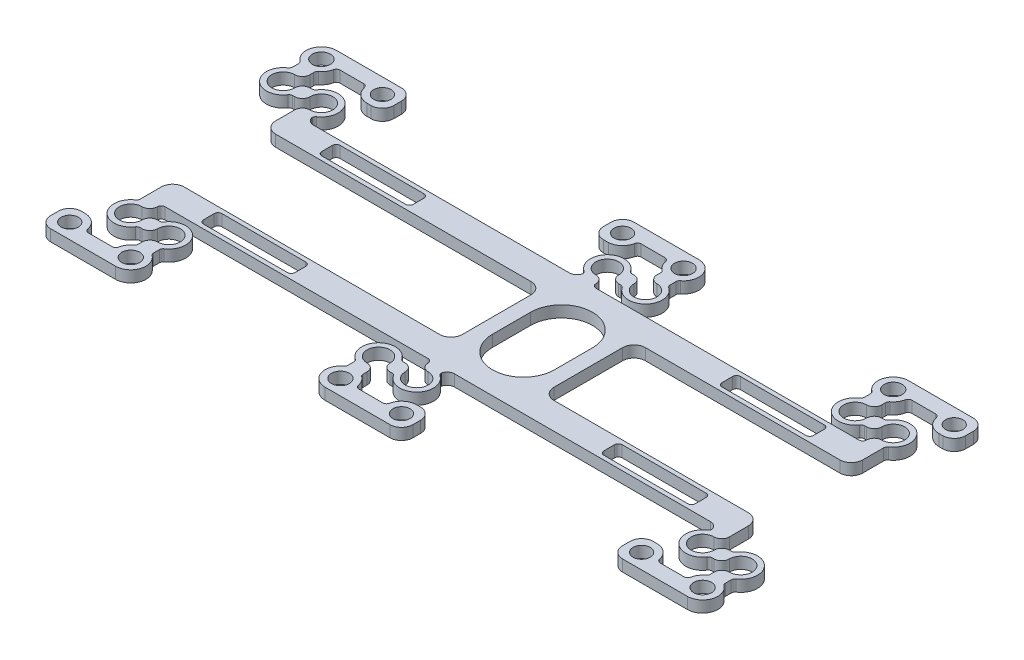
from build123d import *

# Parameters (mm, degrees)
SKETCH1_R           = 2.2500000000000027
SKETCH1_R_2         = 2.3499999999999437
SKETCH1_W           = 24.000000000000004
SKETCH1_H           = 4.799999999999997
SKETCH1_R_3         = 2.2499999999999964
SKETCH1_R_4         = 2.350000007263345
SKETCH1_W_2         = 23.999999999999986
SKETCH1_H_2         = 4.799999999999969
SKETCH1_R_5         = 2.349999999999996
SKETCH1_R_6         = 2.2499999999999987
SKETCH1_R_7         = 2.350000000000016
SKETCH1_R_8         = 2.3500000000368715
BOSS_EXTRUDE1_DEPTH = 3
FILLET1_R           = 3
FILLET2_R           = 2
FILLET3_R           = 1
FILLET4_R           = 3
FILLET5_R           = 1
FILLET6_R           = 2


# Some blends are built 0.0001 mm under size
with BuildPart() as part:
    # Sketch1 → Boss-Extrude1 (new body)
    with BuildSketch(Plane(origin=(0, 33.94852974075286, 0), x_dir=(1, 0, 0), z_dir=(0, 1, 0))):
        with BuildLine():
            Line((-33.51582642738949, -17.917871814791713), (-53.515826427389484, -17.917871814791713))
            ThreePointArc((-53.515826427389484, -17.91787181479171), (-57.379529732545755, -20.882595634381627), (-55.51582642738949, -25.381973429929463))
            Line((-55.51582642738949, -25.381973429929467), (-55.515826427389484, -27.998688226338622))
            ThreePointArc((-55.515826427389484, -27.998688226338622), (-56.627096264610294, -35.02914165201251), (-49.596642838936404, -33.91787181479171))
            Line((-49.596642838936404, -33.91787181479171), (-45.75189440488929, -33.91787181479171))
            ThreePointArc((-45.75189440488929, -33.91787181479171), (-41.39450608382999, -29.796551471231936), (-45.51582642738949, -34.1539397922915))
            Line((-45.51582642738949, -34.1539397922915), (-45.51582642738949, -44.9178718147917))
            Line((-45.51582642738949, -44.9178718147917), (27.484173572610494, -44.9178718147917))
            Line((27.484173572610498, -44.9178718147917), (27.4841735726105, -68.91787181479168))
            Line((27.48417357261051, -68.91787181479168), (-45.51582642738949, -68.9178718147917))
            Line((-45.51582642738949, -68.9178718147917), (-45.515826427389484, -77.99868822633861))
            ThreePointArc((-45.515826427389484, -77.99868822633861), (-46.6270950590721, -85.02914285755026), (-39.59664128903926, -83.91786877762306))
            Line((-39.59664128903926, -83.91786877762306), (-35.75189712141177, -83.91786877762308))
            ThreePointArc((-35.751897121411766, -83.91786877762308), (-31.394504643175516, -79.79655291188737), (-35.51582642738955, -84.15393979229145))
            Line((-35.51582642738955, -84.15393979229145), (-35.51582642738955, -88.4687935184171))
            ThreePointArc((-35.51582642738955, -88.4687935184171), (-36.97054306521985, -89.9276270944568), (-37.502822927829754, -91.91787181479171))
            Line((-37.502822927829754, -91.91787181479171), (-45.51229915471252, -91.91787181479172))
            ThreePointArc((-45.512299154712515, -91.91787181479172), (-46.684580482487576, -89.08727523058104), (-49.51490809269906, -87.91434464743907))
            Line((-49.51490809269906, -87.91434464743907), (-53.51575887941135, -87.91346264172846))
            Line((-53.51575887941135, -87.91346264172846), (-53.51589382775335, -95.91346264059027))
            Line((-53.51589382775335, -95.91346264059027), (-33.516708278678145, -95.91787171758399))
            ThreePointArc((-33.516708278678145, -95.91787171758399), (-29.652237265662105, -92.95357389038188), (-31.51582642738954, -88.45377019965397))
            Line((-31.515826427389545, -88.45377019965397), (-31.515826427389545, -85.83705546221402))
            ThreePointArc((-31.515826427389534, -85.83705546221404), (-30.404557759626346, -78.80660077097274), (-37.43501159522431, -79.91787485196033))
            Line((-37.43501159522432, -79.91787485196033), (-41.27975573336721, -79.91787485196035))
            ThreePointArc((-41.27975573336721, -79.91787485196035), (-45.63714821160335, -84.03919071769616), (-41.5158264273895, -79.68180383729192))
            Line((-41.5158264273895, -79.68180383729192), (-41.515826427389506, -75.91787181479172))
            Line((-41.515826427389506, -75.91787181479172), (29.484173572610523, -75.91787181479172))
            Line((29.484173572610516, -75.91787181479172), (29.48417357261051, -79.6818038372919))
            ThreePointArc((29.484173572610505, -79.6818038372919), (33.60549535682436, -84.03919071769613), (29.248102878588217, -79.91787485196032))
            Line((29.24810287858822, -79.91787485196032), (25.40335874044533, -79.91787485196033))
            ThreePointArc((25.40335874044533, -79.91787485196033), (18.37290490484736, -78.80660077097271), (19.484173572610562, -85.83705546221401))
            Line((19.48417357261056, -85.83705546221402), (19.48417357261056, -88.45377019965395))
            ThreePointArc((19.48417357261056, -88.45377019965395), (17.620584410883133, -92.95357389038183), (21.485055423899155, -95.91787171758394))
            Line((21.485055423899155, -95.91787171758394), (41.48424097297437, -95.91346264059021))
            Line((41.48424097297437, -95.91346264059021), (41.48410602463237, -87.91346264172846))
            Line((41.48410602463237, -87.91346264172846), (37.48325523792007, -87.91434464743907))
            ThreePointArc((37.48325523792007, -87.91434464743907), (34.65292762770859, -89.08727523058104), (33.48064629993353, -91.91787181479172))
            Line((33.48064629993353, -91.91787181479172), (25.471170073050768, -91.91787181479168))
            ThreePointArc((25.471170073050768, -91.91787181479168), (24.93889021044086, -89.92762709445677), (23.484173572610562, -88.46879351841707))
            Line((23.484173572610562, -88.46879351841707), (23.484173572610562, -84.15393979229142))
            ThreePointArc((23.48417357261056, -84.15393979229142), (19.362851788396537, -79.79655291188733), (23.720244266632783, -83.91786877762306))
            Line((23.720244266632786, -83.91786877762306), (27.564988434260272, -83.91786877762306))
            ThreePointArc((27.564988434260275, -83.91786877762306), (34.595442204293086, -85.02914285755023), (33.4841735726105, -77.99868822633861))
            Line((33.4841735726105, -77.99868822633861), (33.48417357261051, -75.91787181479171))
            Line((33.48417357261051, -75.91787181479171), (104.48411814011325, -75.91787181479174))
            Line((104.48411814011327, -75.91787181479174), (104.48473276035557, -77.99998738923574))
            ThreePointArc((104.48473276035557, -77.99998738923573), (103.37353901468369, -85.03097705004149), (110.40425647478723, -83.9180623421807))
            Line((110.40425647478725, -83.91806234218072), (114.24820906374711, -83.91806979449323))
            ThreePointArc((114.24820906374711, -83.91806979449323), (118.60545235287597, -79.79649525390121), (114.4841735662863, -84.15401828166834))
            Line((114.4841735662863, -84.15401828166834), (114.4841735662863, -88.45377029145757))
            ThreePointArc((114.4841735662863, -88.45377029145757), (113.02007180993759, -89.91787192195076), (112.48417336776805, -91.91787202120989))
            Line((112.48417336776805, -91.91787202120989), (104.48417336776805, -91.91787202120987))
            ThreePointArc((104.48417336776805, -91.91787202120987), (103.31260049251424, -89.08944489646369), (100.48417336776805, -87.91787202120989))
            Line((100.48417336776805, -87.91787202120989), (96.48417336776805, -87.91787202120987))
            Line((96.48417336776805, -87.91787202120987), (96.48417336776805, -95.9178720212099))
            Line((96.48417336776805, -95.9178720212099), (116.48417336776805, -95.91787202120992))
            ThreePointArc((116.48417336776805, -95.91787202120992), (120.34787664330945, -92.95314831214436), (118.48417356595493, -88.4537705204954))
            Line((118.48417356595493, -88.4537705204954), (118.48417356595493, -85.83709832436479))
            ThreePointArc((118.48417356595493, -85.83709832436479), (119.59539119652722, -78.80658254766834), (112.5649175150346, -79.91806647589769))
            Line((112.5649175150346, -79.91806647589769), (108.71936209293261, -79.9180594027779))
            ThreePointArc((108.71936209293261, -79.9180594027779), (104.36385600436591, -84.04139483513454), (108.48411814011325, -79.68298132698779))
            Line((108.48411814011325, -79.68298132698779), (108.48411814011325, -77.99868822633863))
            Line((108.48411814011325, -77.99868822633863), (108.48411814011324, -75.89591879788168))
            Line((108.48411814011324, -75.89591879788168), (108.48411814011324, -68.9178718147917))
            Line((108.48411814011324, -68.9178718147917), (51.484173572610494, -68.91787181479168))
            Line((51.484173572610494, -68.91787181479168), (51.484173572610494, -44.9178718147917))
            Line((51.484173572610494, -44.9178718147917), (101.01451384384951, -44.9178718147917))
            Line((101.01451384384951, -44.9178718147917), (108.48411814011324, -44.9178718147917))
            Line((108.48411814011324, -44.9178718147917), (108.48411814011328, -37.939824831701735))
            Line((108.48411814011328, -37.939824831701735), (108.48411814011325, -35.83705540324479))
            ThreePointArc((108.48411814011325, -35.8370554032448), (109.59538797733406, -28.806601977570892), (102.56493455166016, -29.91787181479172))
            Line((102.56493455166016, -29.91787181479172), (98.72018611761308, -29.91787181479172))
            ThreePointArc((98.72018611761308, -29.917871814791724), (94.3627977965534, -34.03919215835108), (98.4841181401133, -29.681803837291916))
            Line((98.4841181401133, -29.68180383729192), (98.48411814011328, -25.381973429929626))
            ThreePointArc((98.48411814011328, -25.38197342992963), (99.94821999991288, -23.917871391025184), (100.4841181401133, -21.91787083614463))
            Line((100.4841181401133, -21.91787083614463), (108.48411814011328, -21.91787148857602))
            ThreePointArc((108.48411814011328, -21.91787148857602), (109.65569090003244, -24.746298824203237), (112.4841181401133, -25.917871814791713))
            Line((112.4841181401133, -25.917871814791713), (116.48411814011328, -25.917871814791713))
            Line((116.48411814011328, -25.917871814791713), (116.48411814011328, -17.917871814791713))
            Line((116.48411814011328, -17.917871814791713), (96.48411814011328, -17.917871814791713))
            ThreePointArc((96.48411814011328, -17.91787181479171), (92.620414834957, -20.882595634381627), (94.48411814011328, -25.381973429929467))
            Line((94.48411814011328, -25.381973429929467), (94.48411814011328, -27.998688226338622))
            ThreePointArc((94.48411814011328, -27.99868822633862), (93.37284830289248, -35.02914165201251), (100.40330172856638, -33.917871814791724))
            Line((100.40330172856638, -33.917871814791724), (104.24805016261348, -33.917871814791724))
            ThreePointArc((104.24805016261348, -33.917871814791724), (108.6054384836728, -29.796551471231954), (104.48411814011327, -34.153939792291496))
            Line((104.48411814011327, -34.1539397922915), (104.48411814011327, -37.91787181479169))
            Line((104.48411814011325, -37.91787181479169), (33.48417357261051, -37.9178718147917))
            Line((33.48417357261051, -37.9178718147917), (33.48417357261051, -34.1539397922915))
            ThreePointArc((33.48417357261051, -34.1539397922915), (29.362853229050856, -29.796551471232064), (33.7202415501103, -33.91787181479171))
            Line((33.7202415501103, -33.91787181479171), (37.564989984157414, -33.91787181479171))
            ThreePointArc((37.564989984157414, -33.91787181479171), (44.59544340983131, -35.02914165201252), (43.484173572610494, -27.99868822633862))
            Line((43.484173572610494, -27.998688226338622), (43.4841735726105, -25.381973429929467))
            ThreePointArc((43.4841735726105, -25.381973429929467), (45.34787687776677, -20.88259563438163), (41.4841735726105, -17.91787181479171))
            Line((41.4841735726105, -17.917871814791713), (21.4841735726105, -17.917871814791713))
            Line((21.4841735726105, -17.917871814791713), (21.4841735726105, -25.917871814791713))
            Line((21.4841735726105, -25.917871814791713), (25.745455167751828, -25.909329183728577))
            ThreePointArc((25.745455167751828, -25.909329183728577), (28.40351651071892, -24.652362043283393), (29.484173572610498, -21.917871814791287))
            Line((29.484173572610498, -21.917871814791287), (37.4841735726105, -21.917871814790445))
            ThreePointArc((37.4841735726105, -21.917871814790445), (38.02007195747243, -23.917871814791162), (39.4841735726105, -25.381973429929467))
            Line((39.4841735726105, -25.381973429929467), (39.4841735726105, -29.68180383729192))
            ThreePointArc((39.4841735726105, -29.68180383729192), (43.60549391617016, -34.03919215835135), (39.24810559511071, -29.917871814791717))
            Line((39.2481055951107, -29.917871814791713), (35.4033571610636, -29.917871814791713))
            ThreePointArc((35.4033571610636, -29.917871814791713), (28.372903735389706, -28.806601977570896), (29.484173572610523, -35.8370554032448))
            Line((29.484173572610523, -35.8370554032448), (29.484173572610516, -37.917871814791695))
            Line((29.484173572610523, -37.917871814791695), (-41.515826427389506, -37.917871814791695))
            Line((-41.515826427389506, -37.917871814791695), (-41.51582642738951, -35.8370554032448))
            ThreePointArc((-41.51582642738951, -35.8370554032448), (-40.404556590168696, -28.806601977570896), (-47.43501001584259, -29.917871814791713))
            Line((-47.43501001584259, -29.917871814791713), (-51.27975844988969, -29.917871814791713))
            ThreePointArc((-51.2797584498897, -29.917871814791717), (-55.63714677094915, -34.03919215835133), (-51.515826427389484, -29.681803837291923))
            Line((-51.515826427389484, -29.68180383729192), (-51.515826427389484, -25.38197342992947))
            ThreePointArc((-51.515826427389484, -25.38197342992947), (-50.05172481225173, -23.917871814791713), (-49.515826427389484, -21.917871814791713))
            Line((-49.515826427389484, -21.917871814791713), (-41.51582642738949, -21.917871814791713))
            ThreePointArc((-41.51582642738949, -21.917871814791713), (-40.344253552135676, -24.746298939537905), (-37.515826427389484, -25.917871814791717))
            Line((-37.515826427389484, -25.917871814791713), (-33.51582642738949, -25.917871814791713))
            Line((-33.51582642738949, -25.917871814791713), (-33.51582642738949, -17.917871814791713))
        make_face()
        with Locations(Location((-49.5158264273896, -91.9178718147917, 0), (0, 0, 270))):
            Circle(SKETCH1_R, mode=Mode.SUBTRACT)
        with Locations(Location((-33.5158264273896, -91.91787181479171, 0), (0, 0, 270))):
            Circle(SKETCH1_R_2, mode=Mode.SUBTRACT)
        with Locations(Location((21.484173572610608, -91.91787181479168, 0), (0, 0, 270))):
            Circle(SKETCH1_R_2, mode=Mode.SUBTRACT)
        with Locations((-20.515826427389513, -72.41787181479171)):
            Rectangle(SKETCH1_W, SKETCH1_H, mode=Mode.SUBTRACT)
        with Locations(Location((37.48417357261061, -91.91787181479167, 0), (0, 0, 270))):
            Circle(SKETCH1_R, mode=Mode.SUBTRACT)
        with Locations(Location((100.48417336776805, -91.91787202120987, 0), (0, 0, 270))):
            Circle(SKETCH1_R_3, mode=Mode.SUBTRACT)
        with Locations(Location((116.48417336776805, -91.91787202120987, 0), (0, 0, 270))):
            Circle(SKETCH1_R_4, mode=Mode.SUBTRACT)
        with Locations((84.48417357261056, -72.41787181479171)):
            Rectangle(SKETCH1_W_2, SKETCH1_H_2, mode=Mode.SUBTRACT)
        with Locations((-20.515826427389513, -41.4178718147917)):
            Rectangle(SKETCH1_W, SKETCH1_H, mode=Mode.SUBTRACT)
        with Locations(Location((-53.515826427389484, -21.917871814791713, 0), (0, 0, 270))):
            Circle(SKETCH1_R_5, mode=Mode.SUBTRACT)
        with Locations(Location((-37.515826427389484, -21.917871814791713, 0), (0, 0, 270))):
            Circle(SKETCH1_R, mode=Mode.SUBTRACT)
        with Locations(Location((25.484173572610498, -21.917871814791713, 0), (0, 0, 270))):
            Circle(SKETCH1_R_6, mode=Mode.SUBTRACT)
        with BuildLine():
            Line((31.384173572610496, -61.9178718147917), (31.384173572610496, -51.91787181479171))
            ThreePointArc((31.384173572610493, -51.91787181479171), (39.484173572610494, -43.8178718147917), (47.584173572610496, -51.91787181479171))
            Line((47.584173572610496, -51.91787181479171), (47.584173572610496, -61.9178718147917))
            ThreePointArc((47.584173572610496, -61.9178718147917), (39.484173572610494, -70.0178718147917), (31.384173572610496, -61.9178718147917))
        make_face(mode=Mode.SUBTRACT)
        with Locations((84.48417357261056, -41.41787181479172)):
            Rectangle(SKETCH1_W_2, SKETCH1_H_2, mode=Mode.SUBTRACT)
        with Locations(Location((41.4841735726105, -21.917871814791713, 0), (0, 0, 270))):
            Circle(SKETCH1_R_7, mode=Mode.SUBTRACT)
        with Locations(Location((96.48411814011328, -21.917871814791713, 0), (0, 0, 270))):
            Circle(SKETCH1_R_8, mode=Mode.SUBTRACT)
        with Locations(Location((112.48411814011328, -21.917871814791713, 0), (0, 0, 270))):
            Circle(SKETCH1_R_3, mode=Mode.SUBTRACT)
    extrude(amount=BOSS_EXTRUDE1_DEPTH)

    # Fillet1
    fillet1_edges = [part.edges().sort_by_distance(p)[0] for p in [
        (-53.51589382775335, 35.44852974075286, 95.91346264059027),
        (-53.51575887941135, 35.44852974075286, 87.91346264172846),
        (-33.51582642738949, 35.44852974075286, 17.917871814791713),
        (-33.51582642738949, 35.44852974075286, 25.917871814791713),
        (21.4841735726105, 35.44852974075286, 25.917871814791713),
        (21.4841735726105, 35.44852974075286, 17.917871814791713),
        (116.48411814011328, 35.44852974075286, 17.917871814791713),
        (116.48411814011328, 35.44852974075286, 25.917871814791713),
        (96.48417336776805, 35.44852974075286, 95.9178720212099),
        (96.48417336776805, 35.44852974075286, 87.91787202120987),
        (41.48410602463237, 35.44852974075286, 87.91346264172846),
        (41.48424097297437, 35.44852974075286, 95.91346264059021),
    ]]
    fillet(fillet1_edges, radius=FILLET1_R)

    # Fillet2
    fillet2_edges = [part.edges().sort_by_distance(p)[0] for p in [
        (29.248102878588217, 35.44852974075286, 79.91787485196032),
        (29.48417357261051, 35.44852974075286, 79.6818038372919),
        (-41.5158264273895, 35.44852974075286, 79.68180383729192),
        (-41.27975573336721, 35.44852974075286, 79.91787485196035),
        (-35.51582642738955, 35.44852974075286, 84.15393979229145),
        (-35.75189712141177, 35.44852974075286, 83.91786877762308),
        (-45.51582642738949, 35.44852974075286, 34.1539397922915),
        (-45.75189440488929, 35.44852974075286, 33.91787181479171),
        (-51.515826427389484, 35.44852974075286, 29.681803837291916),
        (-51.2797584498897, 35.44852974075286, 29.917871814791717),
        (39.2481055951107, 35.44852974075286, 29.917871814791713),
        (39.4841735726105, 35.44852974075286, 29.68180383729192),
        (33.7202415501103, 35.44852974075286, 33.91787181479171),
        (33.48417357261051, 35.44852974075286, 34.1539397922915),
        (104.48411814011327, 35.44852974075286, 34.1539397922915),
        (104.24805016261348, 35.44852974075286, 33.917871814791724),
        (98.4841181401133, 35.44852974075286, 29.681803837291916),
        (98.72018611761308, 35.44852974075286, 29.91787181479172),
        (108.48411814011325, 35.44852974075286, 79.68298132698779),
        (108.71936209293261, 35.44852974075286, 79.9180594027779),
        (114.4841735662863, 35.44852974075286, 84.15401828166834),
        (114.24820906374711, 35.44852974075286, 83.91806979449323),
        (23.720244266632783, 35.44852974075286, 83.91786877762306),
        (23.484173572610562, 35.44852974075286, 84.15393979229142),
    ]]
    fillet(fillet2_edges, radius=FILLET2_R)

    # Fillet3
    fillet3_edges = [part.edges().sort_by_distance(p)[0] for p in [
        (104.48411814011325, 35.44852974075286, 37.91787181479169),
        (108.48411814011325, 35.44852974075286, 35.83705540324479),
        (102.56493455166016, 35.44852974075286, 29.91787181479172),
        (100.40330172856638, 35.44852974075286, 33.917871814791724),
        (94.48411814011328, 35.44852974075286, 27.99868822633862),
        (94.48411814011328, 35.44852974075286, 25.381973429929467),
        (37.564989984157414, 35.44852974075286, 33.91787181479171),
        (43.4841735726105, 35.44852974075286, 25.381973429929467),
        (43.484173572610494, 35.44852974075286, 27.998688226338622),
        (35.4033571610636, 35.44852974075286, 29.917871814791713),
        (29.484173572610523, 35.44852974075286, 35.8370554032448),
        (33.48417357261051, 35.44852974075286, 37.9178718147917),
        (-41.51582642738951, 35.44852974075286, 35.8370554032448),
        (-47.43501001584259, 35.44852974075286, 29.917871814791713),
        (-49.596642838936404, 35.44852974075286, 33.91787181479171),
        (-55.515826427389484, 35.44852974075286, 27.998688226338622),
        (-55.51582642738949, 35.44852974075286, 25.381973429929463),
        (118.48417356595493, 35.44852974075286, 85.83709832436479),
        (104.48473276035557, 35.44852974075286, 77.99998738923574),
        (110.40425647478725, 35.44852974075286, 83.91806234218072),
        (112.5649175150346, 35.44852974075286, 79.91806647589769),
        (118.48417356595493, 35.44852974075286, 88.4537705204954),
        (-31.51582642738954, 35.44852974075286, 88.45377019965397),
        (-31.51582642738954, 35.44852974075286, 85.83705546221404),
        (-37.43501159522431, 35.44852974075286, 79.91787485196033),
        (-39.59664128903926, 35.44852974075286, 83.91786877762306),
        (-45.515826427389484, 35.44852974075286, 77.99868822633861),
        (25.403358740445327, 35.44852974075286, 79.91787485196033),
        (27.564988434260275, 35.44852974075286, 83.91786877762306),
        (33.4841735726105, 35.44852974075286, 77.99868822633861),
        (29.48417357261052, 35.44852974075286, 75.91787181479172),
        (23.484173572610562, 35.44852974075286, 88.46879351841707),
        (-41.51582642738949, 35.44852974075286, 21.917871814791713),
        (-49.515826427389484, 35.44852974075286, 21.917871814791713),
        (37.4841735726105, 35.44852974075286, 21.917871814790445),
        (29.484173572610498, 35.44852974075286, 21.917871814791287),
        (108.48411814011328, 35.44852974075286, 21.91787148857602),
        (100.4841181401133, 35.44852974075286, 21.91787083614463),
        (112.48417336776805, 35.44852974075286, 91.91787202120989),
        (104.48417336776805, 35.44852974075286, 91.91787202120987),
        (33.48064629993353, 35.44852974075286, 91.91787181479172),
        (25.471170073050764, 35.44852974075286, 91.91787181479168),
        (-37.502822927829754, 35.44852974075286, 91.91787181479171),
        (-45.51229915471252, 35.44852974075286, 91.91787181479172),
        (19.48417357261056, 35.44852974075286, 85.83705546221401),
        (19.48417357261056, 35.44852974075286, 88.45377019965395),
        (-41.515826427389506, 35.44852974075286, 75.91787181479172),
        (-35.51582642738955, 35.44852974075286, 88.4687935184171),
        (98.48411814011328, 35.44852974075286, 25.38197342992963),
        (39.4841735726105, 35.44852974075286, 25.381973429929467),
        (-51.515826427389484, 35.44852974075286, 25.38197342992947),
        (114.4841735662863, 35.44852974075286, 88.45377029145757),
    ]]
    fillet(fillet3_edges, radius=FILLET3_R - 0.0001)  # a hair under: the kernel refuses the full size

    # Fillet4
    fillet4_edges = [part.edges().sort_by_distance(p)[0] for p in [
        (-45.51582642738949, 35.44852974075286, 68.9178718147917),
        (27.484173572610505, 35.44852974075286, 68.91787181479168),
        (27.484173572610494, 35.44852974075286, 44.9178718147917),
        (-45.51582642738949, 35.44852974075286, 44.9178718147917),
        (108.48411814011324, 35.44852974075286, 44.9178718147917),
        (51.484173572610494, 35.44852974075286, 44.9178718147917),
        (51.484173572610494, 35.44852974075286, 68.91787181479168),
        (108.48411814011324, 35.44852974075286, 68.9178718147917),
    ]]
    fillet(fillet4_edges, radius=FILLET4_R)

    # Fillet5
    fillet5_edges = [part.edges().sort_by_distance(p)[0] for p in [
        (72.48417357261056, 35.44852974075286, 74.81787181479169),
        (96.48417357261054, 35.44852974075286, 74.81787181479169),
        (96.48417357261054, 35.44852974075286, 70.01787181479172),
        (72.48417357261056, 35.44852974075286, 70.01787181479172),
        (72.48417357261056, 35.44852974075286, 39.01787181479173),
        (72.48417357261056, 35.44852974075286, 43.8178718147917),
        (96.48417357261054, 35.44852974075286, 43.8178718147917),
        (96.48417357261054, 35.44852974075286, 39.01787181479173),
        (-32.51582642738951, 35.44852974075286, 74.81787181479172),
        (-8.51582642738951, 35.44852974075286, 74.81787181479172),
        (-8.51582642738951, 35.44852974075286, 70.01787181479172),
        (-32.51582642738951, 35.44852974075286, 70.01787181479172),
        (-8.51582642738951, 35.44852974075286, 39.017871814791704),
        (-32.51582642738951, 35.44852974075286, 39.017871814791704),
        (-32.51582642738951, 35.44852974075286, 43.8178718147917),
        (-8.51582642738951, 35.44852974075286, 43.8178718147917),
    ]]
    fillet(fillet5_edges, radius=FILLET5_R)

    # Fillet6
    # the kernel refuses this fillet: 2 mm, written as the material it adds along each edge
    with BuildSketch(Plane(origin=(104.48411814011325, 33.94852974075286, 75.91787181479174), x_dir=(-1, 0, 0), z_dir=(0, 1, 0))) as fillet6_piece_1:
        with BuildLine():
            CenterArc((1.9388860623214157, 2), FILLET6_R, 194.14835570581175, 75.85164429418825)
            Line((-0.00044607176759826, 1.5111330715933633), (0, 0))
            Line((0, 0), (1.9388860623214157, 0))
        make_face()
    extrude(amount=3)
    with BuildSketch(Plane(origin=(29.48417357261052, 33.94852974075286, 37.917871814791695), x_dir=(-1, 0, 0), z_dir=(0, 1, 0))) as fillet6_piece_2:
        with BuildLine():
            CenterArc((1.939062477718906, -2), FILLET6_R, 90, 75.82007475066683)
            Line((0, -1.5100645884378068), (0, 0))
            Line((0, 0), (1.939062477718906, 0))
        make_face()
    extrude(amount=3)
    with BuildSketch(Plane(origin=(-41.515826427389506, 33.94852974075286, 37.917871814791695), x_dir=(-4.71e-15, 0, -1), z_dir=(0, 1, 0))) as fillet6_piece_3:
        with BuildLine():
            CenterArc((1.999999999999991, -1.9390624777189012), FILLET6_R, 104.17992524933334, 75.82007475066641)
            Line((-9.12e-15, -1.9390624777188918), (0, 0))
            Line((0, 0), (1.5100645884377926, 0))
        make_face()
    extrude(amount=3)
    with BuildSketch(Plane(origin=(33.48417357261051, 33.94852974075286, 75.91787181479171), x_dir=(0, 0, 1), z_dir=(0, 1, 0))) as fillet6_piece_4:
        with BuildLine():
            CenterArc((2, 1.939062477718906), FILLET6_R, 180, 75.820074750667)
            Line((0, 1.939062477718906), (0, 0))
            Line((0, 0), (1.5100645884378139, 0))
        make_face()
    extrude(amount=3)


solid = part.part
